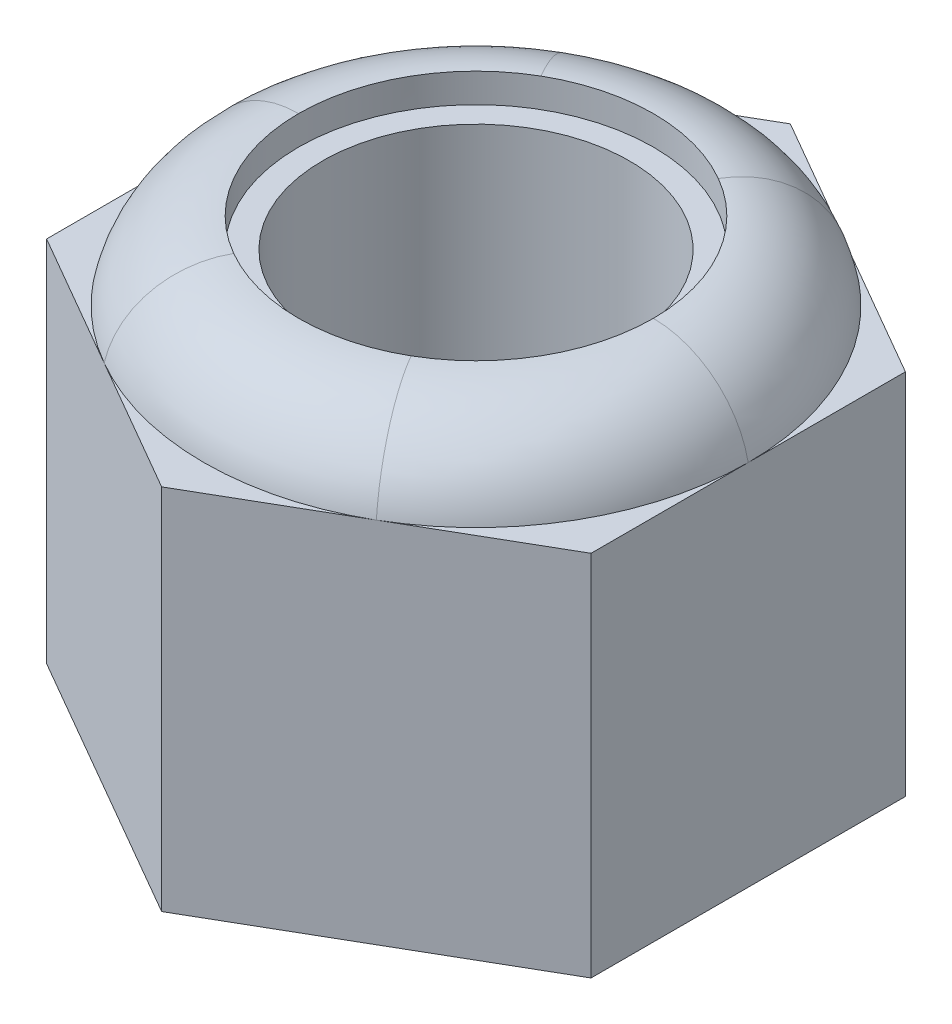
from build123d import *

# Parameters (mm, degrees)
SKETCH1_R           = 4.029111805
BOSS_EXTRUDE3_DEPTH = 9.652
SKETCH3_R           = 7.14375
SKETCH3_R_2         = 4.029111805
BOSS_EXTRUDE4_DEPTH = 2.032
FILLET2_R           = 2.54
SKETCH4_R           = 4.655068421
CUT_EXTRUDE1_DEPTH  = 0.762


with BuildPart() as part:
    # Sketch1 → Boss-Extrude3 (new body)
    with BuildSketch(Plane(origin=(0, 0, 0), x_dir=(1, 0, 0), z_dir=(0, 1, 0))):
        Polygon((-7.14375, 4.124445986), (-7.14375, 0), (-7.14375, -4.124445986), (0, -8.248891971), (3.571875, -6.186668978), (7.14375, -4.124445986), (7.14375, 0), (7.14375, 4.124445986), (0, 8.248891971), (-3.571875, 6.186668978), align=None)
        with Locations(Location((0, 0, 0), (0, 0, 270))):
            Circle(SKETCH1_R, mode=Mode.SUBTRACT)
    extrude(amount=BOSS_EXTRUDE3_DEPTH)

    # Sketch3 → Boss-Extrude4 (add)
    with BuildSketch(Plane(origin=(0, 9.652, 0), x_dir=(1, 0, 0), z_dir=(0, 1, 0))):
        with Locations(Location((0, 0, 0), (0, 0, 60))):
            Circle(SKETCH3_R)
        with Locations(Location((0, 0, 0), (0, 0, 270))):
            Circle(SKETCH3_R_2, mode=Mode.SUBTRACT)
    extrude(amount=BOSS_EXTRUDE4_DEPTH)

    # Fillet2
    # the kernel refuses this fillet: 2.54 mm, written as the material it takes off along each edge
    with BuildSketch(Plane(origin=(0, 11.684, 0), x_dir=(0.5000000000000001, 0, -0.8660254037844386), z_dir=(0.8660254037844386, 0, 0.5000000000000001))) as fillet2_piece_1:
        with BuildLine():
            CenterArc((4.655068421, -2.54), FILLET2_R, 11.536959033, 78.463040967)
            Line((7.14375, -2.032), (7.193523632, -2.02184))
            ThreePointArc((7.193523632, -2.02184), (7.19455, -1.016), (7.19455, 0))
            Line((7.19455, 0), (7.14375, 0.0508))
            Line((7.14375, 0.0508), (4.655068421, 0.0508))
            Line((4.655068421, 0.0508), (4.655068421, 0))
        make_face()
    revolve(axis=Axis((0, 11.684, 0), (0, 1, 0)), mode=Mode.SUBTRACT)

    # Sketch4 → Cut-Extrude1 (cut)
    with BuildSketch(Plane(origin=(0, 11.684, 0), x_dir=(1, 0, 0), z_dir=(0, 1, 0))):
        with Locations(Location((0, 0, 0), (0, 0, 270))):
            Circle(SKETCH4_R)
    extrude(amount=-CUT_EXTRUDE1_DEPTH, mode=Mode.SUBTRACT)


solid = part.part
